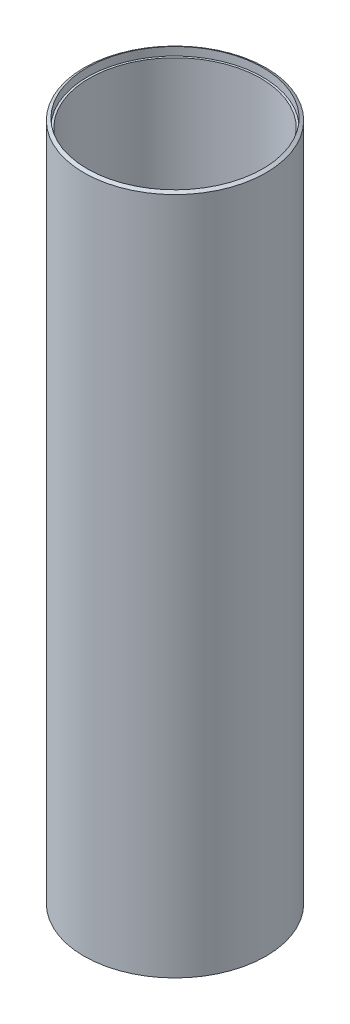
from build123d import *


with BuildPart() as part:
    # Sketch2 → Revolve1 (revolve)
    with BuildSketch(Plane.XY):
        Polygon((-69.85, 1.429807942), (-69.85, 522.129807942), (-67.3735, 523.559615883), (-67.3735, 517.209615883), (-65.786, 517.209615883), (-65.786, 6.35), (-67.3735, 6.35), (-67.3735, 0), align=None)
    revolve(axis=Axis((0, 819.187021794, 0), (0, -1, 0)))


solid = part.part
